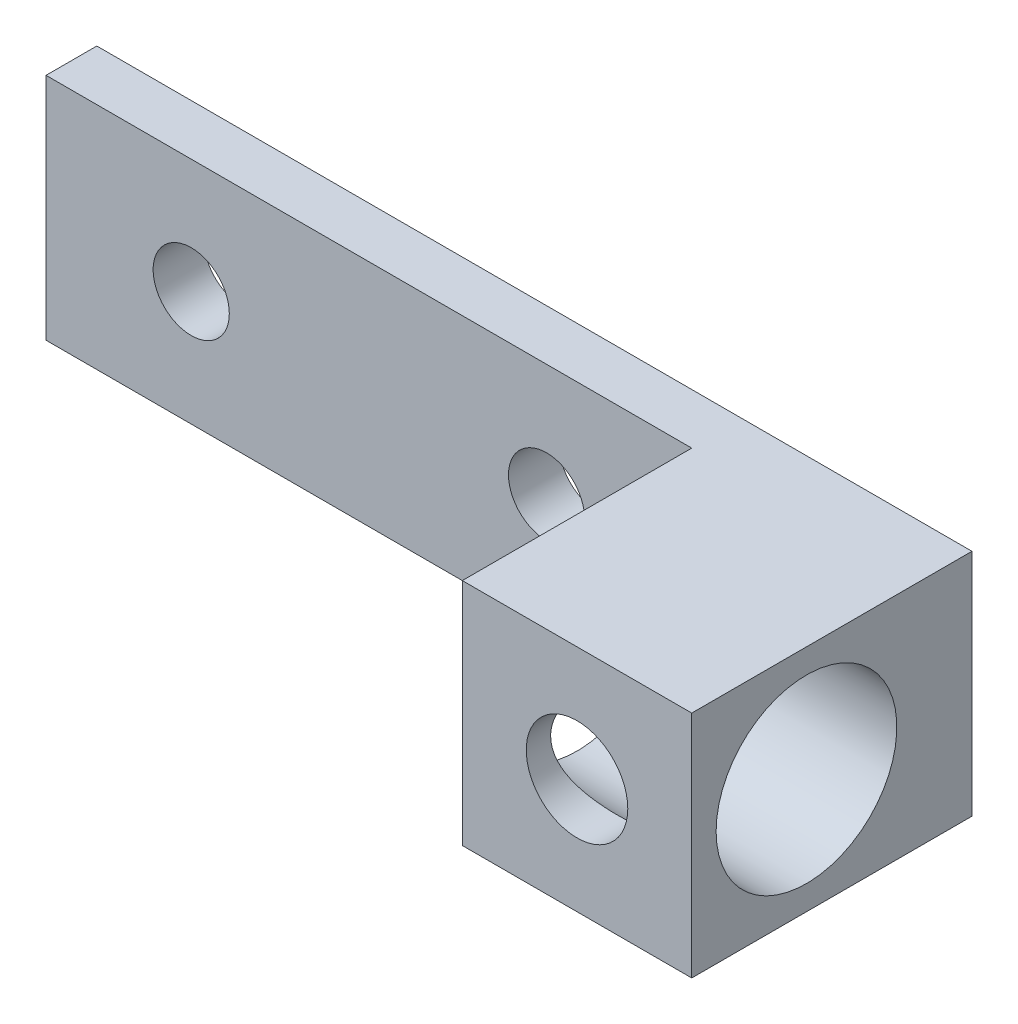
from build123d import *

# Parameters (mm, degrees)
EXTRUDE1_DEPTH = 28.702
SKETCH2_R      = 11.303
EXTRUDE2_DEPTH = 93.609737566
SKETCH3_R      = 6.35
EXTRUDE3_DEPTH = 12.7
SKETCH4_R      = 4.7625
EXTRUDE4_DEPTH = 117.756868277


with BuildPart() as part:
    # Sketch1 → Extrude1 (new body)
    with BuildSketch(Plane(origin=(0, 0, 0), x_dir=(1, 0, 0), z_dir=(0, 1, 0))):
        Polygon((0, 0), (0, -35.052), (-28.702, -35.052), (-28.702, -6.35), (-109.474, -6.35), (-109.474, 0), align=None)
    extrude(amount=EXTRUDE1_DEPTH)

    # Sketch2 → Extrude2 (cut, through all)
    with BuildSketch(Plane.ZY.offset(28.702)):
        with Locations((20.701, 14.351)):
            Circle(SKETCH2_R)
    extrude(amount=-EXTRUDE2_DEPTH, mode=Mode.SUBTRACT)

    # Sketch3 → Extrude3 (cut)
    with BuildSketch(Plane.XY.offset(35.052)):
        with Locations((-14.351, 14.351)):
            Circle(SKETCH3_R)
    extrude(amount=-EXTRUDE3_DEPTH, mode=Mode.SUBTRACT)

    # Sketch4 → Extrude4 (cut, through all)
    with BuildSketch(Plane.XY.offset(6.35)):
        with Locations((-91.313, 14.351)):
            Circle(SKETCH4_R)
        with Locations((-46.863, 14.351)):
            Circle(SKETCH4_R)
    extrude(amount=-EXTRUDE4_DEPTH, mode=Mode.SUBTRACT)


solid = part.part
